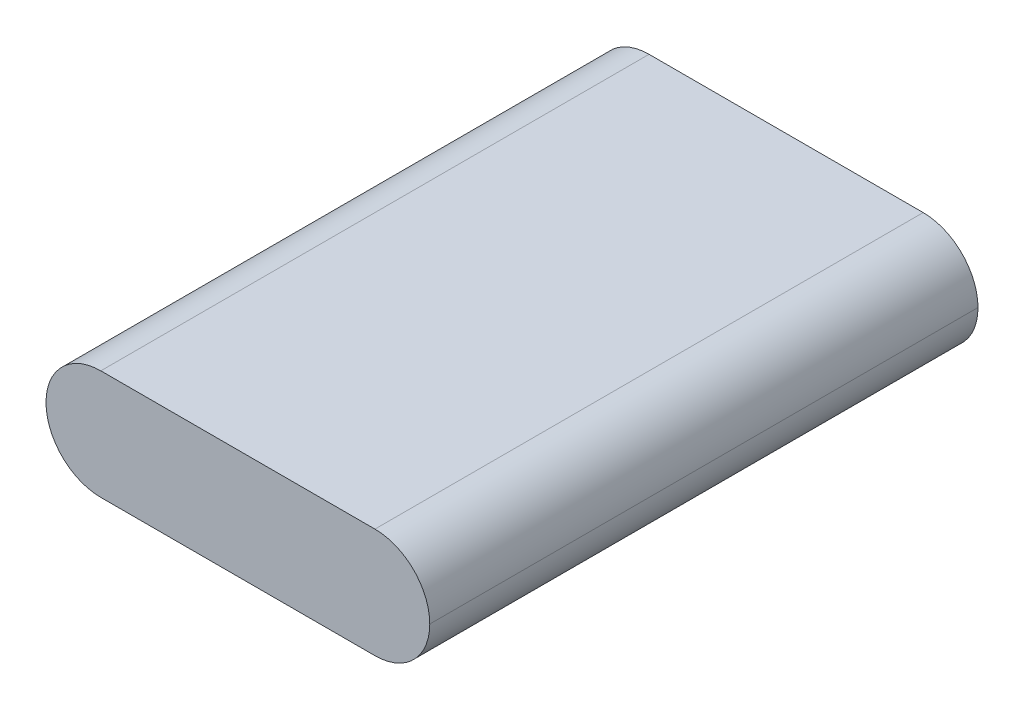
from build123d import *

# Parameters (mm, degrees)
SKETCH1_W           = 35
SKETCH1_H           = 50
BOSS_EXTRUDE1_DEPTH = 10
FILLET1_R           = 5


with BuildPart() as part:
    # Sketch1 → Boss-Extrude1 (new body)
    with BuildSketch(Plane(origin=(0, 0, 0), x_dir=(1, 0, 0), z_dir=(0, 1, 0))):
        Rectangle(SKETCH1_W, SKETCH1_H)
    extrude(amount=BOSS_EXTRUDE1_DEPTH)

    # Fillet1
    fillet1_edges = [part.edges().sort_by_distance(p)[0] for p in [
        (-17.5, 0, 0),
        (-17.5, 10, 0),
        (17.5, 0, 0),
        (17.5, 10, 0),
    ]]
    fillet(fillet1_edges, radius=FILLET1_R - 0.0001)  # a hair under: the kernel refuses the full size


solid = part.part
